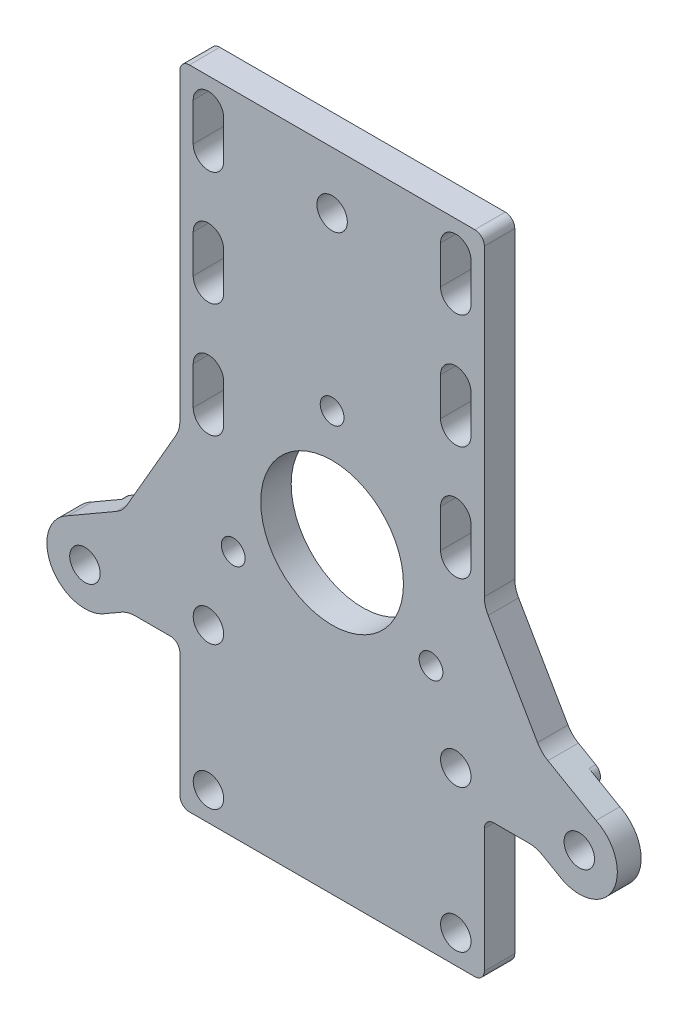
from build123d import *
from build123d.topology import SkipClean

# Parameters (mm, degrees)
SKETCH2_R               = 7.5
BOSS_EXTRUDE1_DEPTH     = 2.8
M3_CLEARANCE_HOLE1_D    = 3.2
M3X0_5_TAPPED_HOLE1_D   = 2.5
SKETCH8_R               = 1.25
SKETCH8_R_2             = 7.5
BOSS_EXTRUDE2_DEPTH     = 0.7
CUT_EXTRUDE1_DEPTH      = 46.416804125
CUT_EXTRUDE1_DEPTH_BACK = 46.416804125
FILLET3_R               = 2.5
MOVE_FACE2_BY           = 0.1
SKETCH18_R              = 1.25
SKETCH18_R_2            = 7.5
SKETCH18_R_3            = 1.6
BOSS_EXTRUDE5_DEPTH     = 3.4
MOVE_START              = -17
MOVE_FACE5_OUTLINE_W    = 42.925322608
MOVE_FACE5_OUTLINE_H    = 3.4
MOVE_FACE5_DEPTH        = 2
SKETCH19_R              = 4
CUT_EXTRUDE3_DEPTH      = 0.7
FILLET5_R               = 1
MOVE_FACE3_BY           = 0.2
MOVE_FACE4_BY           = 0.2
FILLET6_R               = 3
CUT_EXTRUDE4_DEPTH      = 47.958344273
SKETCH22_R              = 1.6
CUT_EXTRUDE7_DEPTH      = 47.958344273
SKETCH25_W              = 32
SKETCH25_H              = 15
BOSS_EXTRUDE6_DEPTH     = 3.2
M3_CLEARANCE_HOLE2_D    = 3.2
FILLET7_R               = 1


with BuildPart() as part:
    # Sketch2 → Boss-Extrude1 (new body)
    with BuildSketch(Plane.XY):
        with BuildLine():
            Line((27.745372612, -11.410271628), (3.991101213, 29.733333333))
            ThreePointArc((3.991101213, 29.733333333), (0, 34), (-3.991101213, 29.733333333))
            Line((-3.991101213, 29.733333333), (-27.745372612, -11.410271628))
            ThreePointArc((-27.745372612, -11.410271628), (-29.444863729, -17), (-23.7542714, -18.323061706))
            Line((-23.7542714, -18.323061706), (23.7542714, -18.323061706))
            ThreePointArc((23.7542714, -18.323061706), (29.444863729, -17), (27.745372612, -11.410271628))
        make_face()
        Circle(SKETCH2_R, mode=Mode.SUBTRACT)
    extrude(amount=BOSS_EXTRUDE1_DEPTH)

    # M3 Clearance Hole1 (through all)
    with Locations(Plane.XY.offset(2.8)):
        with Locations((0, 30), (-25.980762114, -15), (25.980762114, -15)):
            Hole(M3_CLEARANCE_HOLE1_D / 2)

    # M3x0.5 Tapped Hole1 (through all)
    with Locations(Plane(origin=(0, 0, 0), x_dir=(-1, 0, 0), z_dir=(0, 0, -1))):
        with Locations((10.392304845, -6), (0, 12), (-10.392304845, -6)):
            Hole(M3X0_5_TAPPED_HOLE1_D / 2)

    # Sketch8 → Boss-Extrude2 (add)
    with SkipClean():  # the faces are left unmerged after this step: merging them gives an invalid solid
        with BuildSketch(Plane(origin=(0, 0, 0), x_dir=(-1, 0, 0), z_dir=(0, 0, -1))):
            with BuildLine():
                Line((-3.464101615, 14), (-13.856406461, -4))
                ThreePointArc((-13.856406461, -4), (-13.856406461, -8), (-10.392304845, -10))
                Line((-10.392304845, -10), (10.392304845, -10))
                ThreePointArc((10.392304845, -10), (13.856406461, -8), (13.856406461, -4))
                Line((13.856406461, -4), (3.464101615, 14))
                ThreePointArc((3.464101615, 14), (0, 16), (-3.464101615, 14))
            make_face()
            with Locations((-10.392304845, -6)):
                Circle(SKETCH8_R, mode=Mode.SUBTRACT)
            with Locations((0, 12)):
                Circle(SKETCH8_R, mode=Mode.SUBTRACT)
            with Locations((10.392304845, -6)):
                Circle(SKETCH8_R, mode=Mode.SUBTRACT)
            Circle(SKETCH8_R_2, mode=Mode.SUBTRACT)
        extrude(amount=BOSS_EXTRUDE2_DEPTH)
    add(part.part.scale(1), mode=Mode.REPLACE)  # the faces are merged on a copy

    # Sketch9 → Cut-Extrude1 (cut, two sides: drawn at the far end of the back side and taken through both)
    with BuildSketch(Plane(origin=(0, 0, 0), x_dir=(-1, 0, 0), z_dir=(0, 0, -1)).offset(-CUT_EXTRUDE1_DEPTH_BACK)):
        Polygon((27.745372612, -11.410271628), (3.991101213, 29.733333333), (3.991101213, 17.087209922), (16.793508478, -5.087209922), align=None)
        Polygon((12.802407266, -12), (-12.802407266, -12), (-23.7542714, -18.323061706), (23.7542714, -18.323061706), align=None)
        Polygon((-16.793508478, -5.087209922), (-3.991101213, 17.087209922), (-3.991101213, 29.733333333), (-27.745372612, -11.410271628), align=None)
    extrude(amount=CUT_EXTRUDE1_DEPTH + CUT_EXTRUDE1_DEPTH_BACK, mode=Mode.SUBTRACT)

    # Fillet3
    fillet3_edges = [part.edges().sort_by_distance(p)[0] for p in [
        (3.991101213, 17.087209922, 1.4),
        (16.793508478, -5.087209922, 1.4),
        (12.802407266, -12, 1.4),
        (-12.802407266, -12, 1.4),
        (-16.793508478, -5.087209922, 1.4),
        (-3.991101213, 17.087209922, 1.4),
    ]]
    fillet(fillet3_edges, radius=FILLET3_R)

    # Move Face2: a face moved inward by 0.1
    extrude(part.faces().sort_by_distance((0, 20.75, 2.8))[0], amount=MOVE_FACE2_BY, dir=(0, 0, -1), mode=Mode.SUBTRACT)

    # Sketch18 → Boss-Extrude5 (add)
    with BuildSketch(Plane.XY.offset(2.7)):
        with BuildLine():
            Line((-17.998559688, -15), (17.998559688, -15))
            Line((17.998559688, -15), (23.7542714, -18.323061706))
            ThreePointArc((23.7542714, -18.323061706), (29.444863729, -17), (27.745372612, -11.410271628))
            Line((27.745372612, -11.410271628), (21.989660901, -8.087209922))
            Line((21.989660901, -8.087209922), (16, 2.287187079))
            Line((16, 2.287187079), (16, 36))
            Line((16, 36), (-16, 36))
            Line((-16, 36), (-16, 2.287187079))
            Line((-16, 2.287187079), (-21.989660901, -8.087209922))
            Line((-21.989660901, -8.087209922), (-27.745372612, -11.410271628))
            ThreePointArc((-27.745372612, -11.410271628), (-29.444863729, -17), (-23.7542714, -18.323061706))
            Line((-23.7542714, -18.323061706), (-17.998559688, -15))
        make_face()
        with Locations(Location((0, 12, 0), (0, 0, 180))):
            Circle(SKETCH18_R, mode=Mode.SUBTRACT)
        with Locations(Location((10.392304845, -6, 0), (0, 0, 180))):
            Circle(SKETCH18_R, mode=Mode.SUBTRACT)
        with Locations(Location((-10.392304845, -6, 0), (0, 0, 180))):
            Circle(SKETCH18_R, mode=Mode.SUBTRACT)
        with Locations(Location((0, 0, 0), (0, 0, 180))):
            Circle(SKETCH18_R_2, mode=Mode.SUBTRACT)
        with Locations((0, 30)):
            Circle(SKETCH18_R_3, mode=Mode.SUBTRACT)
        with Locations((-25.980762114, -15)):
            Circle(SKETCH18_R_3, mode=Mode.SUBTRACT)
        with Locations((25.980762114, -15)):
            Circle(SKETCH18_R_3, mode=Mode.SUBTRACT)
    extrude(amount=-BOSS_EXTRUDE5_DEPTH)

    # Move Face5: read off the stored shape, not the designer's step
    # Move Face5 outline → Move Face5 (add)
    with BuildSketch(Plane(origin=(0, 0, 0), x_dir=(1, 0, 0), z_dir=(0, 1, 0)).offset(MOVE_START)):
        with Locations((0, -1)):
            Rectangle(MOVE_FACE5_OUTLINE_W, MOVE_FACE5_OUTLINE_H)
    extrude(amount=MOVE_FACE5_DEPTH)

    # Sketch19 → Cut-Extrude3 (cut)
    with BuildSketch(Plane(origin=(0, 0, -0.7), x_dir=(-1, 0, 0), z_dir=(0, 0, -1))):
        with Locations((25.980762114, -15)):
            Circle(SKETCH19_R)
        with Locations((-25.980762114, -15)):
            Circle(SKETCH19_R)
        with Locations((0, 30)):
            Circle(SKETCH19_R)
    extrude(amount=-CUT_EXTRUDE3_DEPTH, mode=Mode.SUBTRACT)

    # Fillet5
    # the kernel refuses this fillet: 1 mm, written as the material it takes off along each edge
    with BuildSketch(Plane(origin=(-23.7542714, -18.323061706, 0), x_dir=(0.5630065866190214, 0.8264524084444297, 0), z_dir=(0, 0, -1)), Plane(origin=(23.7542714, -18.323061706, -8.164117066), x_dir=(-0.5630065866190195, 0.826452408444431, -1.7271463390342054e-15), z_dir=(0, 0, 1))) as fillet5_piece_1:
        with BuildLine():
            CenterArc((3.35885268, 0.92774856), FILLET5_R, 167.216617388, 80.869915665)
            Line((2.383639111, 1.149014228), (0, 0))
            ThreePointArc((0, 0), (1.492823413, 0.289005759), (2.985646826, 0))
        make_face()
    extrude(amount=8.164117066, mode=Mode.SUBTRACT)
    with BuildSketch(Plane(origin=(-27.745372612, -11.410271628, 0), x_dir=(0.9996753598266718, 0.025478911974695106, 0), z_dir=(0, 0, -1)), Plane(origin=(27.745372612, -11.410271628, -10.049979958), x_dir=(-0.9996753598266713, 0.02547891197471748, -2.7505093848186077e-14), z_dir=(0, 0, 1))) as fillet5_piece_2:
        with BuildLine():
            CenterArc((3.763294339, -0.90838084), FILLET5_R, 114.717454154, 126.742537963)
            Line((3.285522044, -1.786864553), (0, 0))
            ThreePointArc((0, 0), (1.672575262, -0.366476642), (3.345150524, 0))
        make_face()
    extrude(amount=10.049979958, mode=Mode.SUBTRACT)
    with BuildSketch(Plane(origin=(-16, 36, 5.2), x_dir=(0, -1, 0), z_dir=(0, 0, -1)), Plane(origin=(16, 36, 5.2), x_dir=(-1, 0, 0), z_dir=(0, 0, -1))) as fillet5_piece_3:
        with BuildLine():
            CenterArc((FILLET5_R, -FILLET5_R), FILLET5_R, 90, 90)
            Line((0, -FILLET5_R), (0, 0))
            Line((0, 0), (FILLET5_R, 0))
        make_face()
    extrude(amount=8.4, mode=Mode.SUBTRACT)

    # Move Face3: a curved face moved inward by 0.2
    add(Solid.thicken(part.faces().sort_by_distance((4, 30, -0.35))[0], -MOVE_FACE3_BY), mode=Mode.SUBTRACT)

    # Move Face4: a face moved inward by 0.2
    extrude(part.faces().sort_by_distance((0, 8.5, 2.7))[0], amount=MOVE_FACE4_BY, dir=(0, 0, -1), mode=Mode.SUBTRACT)

    # Fillet6
    fillet6_edges = [part.edges().sort_by_distance(p)[0] for p in [
        (-21.989660901, -8.087209922, 0.9),
        (21.989660901, -8.087209922, 0.9),
        (21.462661304, -17, 1.25),
        (16, 2.287187079, 0.9),
        (-16, 2.287187079, 0.9),
        (-21.462661304, -17, 1.25),
    ]]
    fillet(fillet6_edges, radius=FILLET6_R)

    # Sketch20 → Cut-Extrude4 (cut, through all)
    with BuildSketch(Plane(origin=(0, 0, -0.7), x_dir=(-1, 0, 0), z_dir=(0, 0, -1))):
        with BuildLine():
            Line((14.6, 33), (14.6, 29))
            ThreePointArc((14.6, 29), (13, 27.4), (11.4, 29))
            Line((11.4, 29), (11.4, 33))
            ThreePointArc((11.4, 33), (13, 34.6), (14.6, 33))
        make_face()
        with BuildLine():
            Line((11.4, 21), (11.4, 17))
            ThreePointArc((11.4, 17), (13, 15.4), (14.6, 17))
            Line((14.6, 17), (14.6, 21))
            ThreePointArc((14.6, 21), (13, 22.6), (11.4, 21))
        make_face()
        with BuildLine():
            Line((11.4, 9), (11.4, 5))
            ThreePointArc((11.4, 5), (13, 3.4), (14.6, 5))
            Line((14.6, 5), (14.6, 9))
            ThreePointArc((14.6, 9), (13, 10.6), (11.4, 9))
        make_face()
        with BuildLine():
            Line((-14.6, 33), (-14.6, 29))
            ThreePointArc((-14.6, 29), (-13, 27.4), (-11.4, 29))
            Line((-11.4, 29), (-11.4, 33))
            ThreePointArc((-11.4, 33), (-13, 34.6), (-14.6, 33))
        make_face()
        with BuildLine():
            Line((-14.6, 21), (-14.6, 17))
            ThreePointArc((-14.6, 17), (-13, 15.4), (-11.4, 17))
            Line((-11.4, 17), (-11.4, 21))
            ThreePointArc((-11.4, 21), (-13, 22.6), (-14.6, 21))
        make_face()
        with BuildLine():
            Line((-14.6, 9), (-14.6, 5))
            ThreePointArc((-14.6, 5), (-13, 3.4), (-11.4, 5))
            Line((-11.4, 5), (-11.4, 9))
            ThreePointArc((-11.4, 9), (-13, 10.6), (-14.6, 9))
        make_face()
    extrude(amount=-CUT_EXTRUDE4_DEPTH, mode=Mode.SUBTRACT)

    # Sketch22 → Cut-Extrude7 (cut, through all)
    with BuildSketch(Plane(origin=(0, 0, -0.7), x_dir=(-1, 0, 0), z_dir=(0, 0, -1))):
        with Locations((13, -14)):
            Circle(SKETCH22_R)
        with Locations((-13, -14)):
            Circle(SKETCH22_R)
    extrude(amount=-CUT_EXTRUDE7_DEPTH, mode=Mode.SUBTRACT)

    # Sketch25 → Boss-Extrude6 (add)
    with BuildSketch(Plane(origin=(0, 0, -0.7), x_dir=(-1, 0, 0), z_dir=(0, 0, -1))):
        with Locations((0, -24.5)):
            Rectangle(SKETCH25_W, SKETCH25_H)
    extrude(amount=-BOSS_EXTRUDE6_DEPTH)

    # M3 Clearance Hole2 (through all)
    with Locations(Plane(origin=(0, 0, -0.7), x_dir=(-1, 0, 0), z_dir=(0, 0, -1))):
        with Locations((-13, -29), (13, -29)):
            Hole(M3_CLEARANCE_HOLE2_D / 2)

    # Fillet7
    fillet7_edges = [part.edges().sort_by_distance(p)[0] for p in [
        (-16, -32, 0.9),
        (-16, -17, 0.9),
        (16, -17, 0.9),
        (16, -32, 0.9),
    ]]
    fillet(fillet7_edges, radius=FILLET7_R)


solid = part.part
